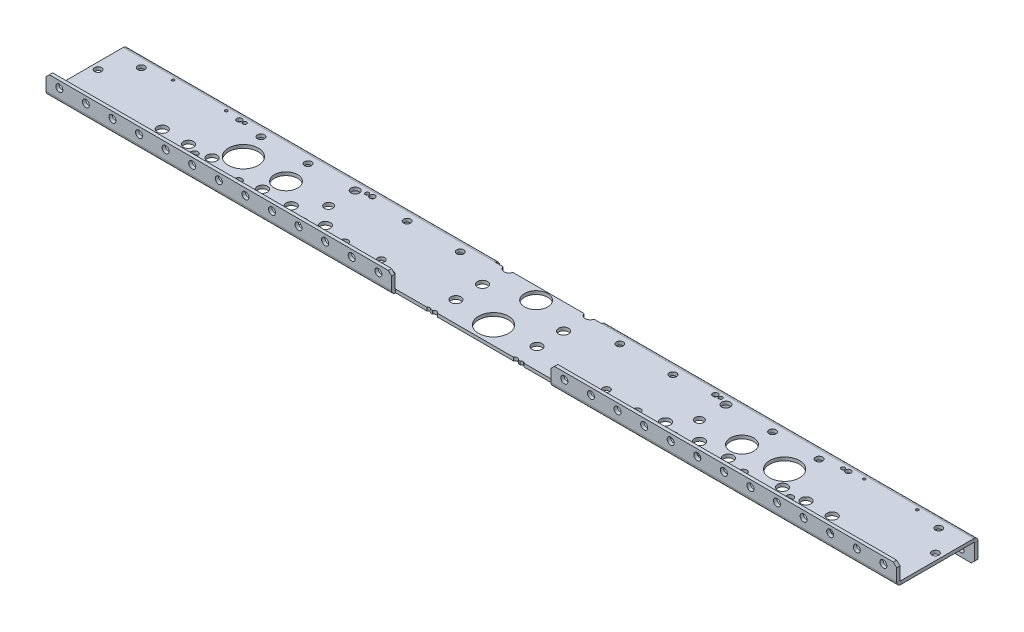
from build123d import *

# Parameters (mm, degrees)
SKETCH1_W                              = 812.8
SKETCH1_H                              = 69.85
BOSS_EXTRUDE1_DEPTH                    = 3.175
SKETCH3_R                              = 14.2875
CUT_EXTRUDE1_DEPTH                     = 816.802024467
EDGE_FLANGE1_DEPTH                     = 812.8
EDGE_FLANGE2_DEPTH                     = 812.8
SKETCH10_R                             = 4.826
LONG_6WD_DEPTH                         = 817.444922817
SKETCH11_R                             = 4.826
SHORT_6WD_DEPTH                        = 817.444922817
SKETCH12_R                             = 3.3528
F_8WD_EGG_DEPTH                        = 817.444922817
SKETCH13_R                             = 3.3528
LOWER_CHURRO_DEPTH                     = 817.444922817
SKETCH14_R                             = 2.667
UPPER_FLANGE_HP_DEPTH                  = 817.729920277
SKETCH16_R                             = 3.3528
LOWER_FLANGE_HP_DEPTH                  = 817.433889486
LPATTERN1_COUNT                        = 32
LPATTERN1_PITCH                        = 25.4
SKETCH17_W                             = 152.4
SKETCH17_H                             = 6.35
CUT_EXTRUDE9_DEPTH                     = 818.031193633
SKETCH18_W                             = 146.05
SKETCH18_H                             = 3.175
BOSS_EXTRUDE2_DEPTH                    = 19.05
SKETCH19_W                             = 101.6
SKETCH19_H                             = 3.937
CUT_EXTRUDE10_DEPTH                    = 818.031193633
SKETCH20_W                             = 95.25
SKETCH20_H                             = 3.175
BOSS_EXTRUDE3_DEPTH                    = 27.432
CUT_EXTRUDE14_DEPTH                    = 819.902667079
SKETCH21_R                             = 11.1125
SKETCH21_R_2                           = 4.7625
SKETCH21_R_3                           = 2.54
SKETCH21_R_4                           = 2.032
TB_MINI_SHAFT_PLATE_DEPTH              = 819.8226487
CUT_EXTRUDE12_DEPTH                    = 819.8226487
SKETCH23_R                             = 3.3528
UPPER_INTERNAL_CHIRRO_HP_DEPTH         = 819.8226487
SKETCH24_R                             = 1.27
CUTTING_GUIDES_DEPTH                   = 819.8226487
SKETCH26_R                             = 3.4036
SONIC_MOUNTING_HOLES_DEPTH             = 819.902667079
SKETCH29_R                             = 2.5527
SKETCH29_R_2                           = 1.7859375
SKETCH29_R_3                           = 14.2875
SKETCH29_R_4                           = 11.1125
SKETCH29_R_5                           = 4.064
TB_MICRO_MOUNTING_DEPTH                = 819.902667079
FILLET1_R                              = 3.175
CHAMFER1_SIZE                          = 3.175
SKETCH30_R                             = 3.3528
BOTTOM_CORNER_SUPPORT_USE_CHURRO_DEPTH = 819.902667079
SKETCH32_R                             = 3.3528
CUT_EXTRUDE15_DEPTH                    = 819.902667079
SKETCH33_R                             = 3.3528
CUT_EXTRUDE16_DEPTH                    = 819.902667079
CUT_EXTRUDE17_DEPTH                    = 12.7


# Sheet-metal steps are written as plain solids
with BuildPart() as part:
    # Sketch1 → Boss-Extrude1 (new body)
    with BuildSketch(Plane(origin=(0, 0, 0), x_dir=(1, 0, 0), z_dir=(0, 1, 0))):
        with Locations((406.4, 34.925)):
            Rectangle(SKETCH1_W, SKETCH1_H)
    extrude(amount=BOSS_EXTRUDE1_DEPTH)

    # Sketch3 → Cut-Extrude1 (cut, through all)
    with BuildSketch(Plane(origin=(0, 3.175, 0), x_dir=(1, 0, 0), z_dir=(0, 1, 0))):
        with Locations(Location((406.4, 17.272, 0), (0, 0, 270))):
            Circle(SKETCH3_R)
    extrude(amount=-CUT_EXTRUDE1_DEPTH, mode=Mode.SUBTRACT)

    # Edge-Flange1 section (across the edge) → Edge-Flange1 (add)
    with BuildSketch(Plane(origin=(0, 3.175, 0.762), x_dir=(0, 0, -1), z_dir=(1, 0, 0))):
        with BuildLine():
            Line((-3.175, 0.762), (-3.175, 15.875))
            Line((-3.175, 15.875), (0, 15.875))
            Line((0, 15.875), (0, 0.762))
            ThreePointArc((0, 0.762), (0.223184633, 0.223184633), (0.762, 0))
            Line((0.762, 0), (0.762, -3.175))
            ThreePointArc((0.762, -3.175), (-2.021879398, -2.021879398), (-3.175, 0.762))
        make_face()
    extrude(amount=EDGE_FLANGE1_DEPTH)

    # Edge-Flange2 section (across the edge) → Edge-Flange2 (add)
    with BuildSketch(Plane(origin=(0, 0, -70.612), x_dir=(0, 0, 1), z_dir=(1, 0, 0))):
        with BuildLine():
            Line((-3.175, 0.762), (-3.175, 19.05))
            Line((-3.175, 19.05), (0, 19.05))
            Line((0, 19.05), (0, 0.762))
            ThreePointArc((0, 0.762), (0.223184633, 0.223184633), (0.762, 0))
            Line((0.762, 0), (0.762, -3.175))
            ThreePointArc((0.762, -3.175), (-2.021879398, -2.021879398), (-3.175, 0.762))
        make_face()
    extrude(amount=EDGE_FLANGE2_DEPTH)

    # Sketch10 → Long 6wd (cut, through all)
    with BuildSketch(Plane(origin=(0, 3.175, 0), x_dir=(1, 0, 0), z_dir=(0, 1, 0))):
        with Locations(Location((86.339113657, 20.828, 0), (0, 0, 270))):
            Circle(SKETCH10_R)
        with Locations(Location((111.349627997, 20.828, 0), (0, 0, 270))):
            Circle(SKETCH10_R)
        with Locations(Location((133.855797334, 20.828, 0), (0, 0, 270))):
            Circle(SKETCH10_R)
        with Locations(Location((726.460886343, 20.828, 0), (0, 0, 270))):
            Circle(SKETCH10_R)
        with Locations(Location((701.450372003, 20.828, 0), (0, 0, 270))):
            Circle(SKETCH10_R)
        with Locations(Location((678.944202666, 20.828, 0), (0, 0, 270))):
            Circle(SKETCH10_R)
    extrude(amount=-LONG_6WD_DEPTH, mode=Mode.SUBTRACT)

    # Sketch11 → Short 6wd (cut, through all)
    with BuildSketch(Plane(origin=(0, 3.175, 0), x_dir=(1, 0, 0), z_dir=(0, 1, 0))):
        with Locations(Location((183.852302373, 19.05, 0), (0, 0, 270))):
            Circle(SKETCH11_R)
        with Locations(Location((211.361504088, 19.05, 0), (0, 0, 270))):
            Circle(SKETCH11_R)
        with Locations(Location((243.875125248, 19.05, 0), (0, 0, 270))):
            Circle(SKETCH11_R)
        with Locations(Location((568.924874752, 19.05, 0), (0, 0, 270))):
            Circle(SKETCH11_R)
        with Locations(Location((601.438495912, 19.05, 0), (0, 0, 270))):
            Circle(SKETCH11_R)
        with Locations(Location((628.947697627, 19.05, 0), (0, 0, 270))):
            Circle(SKETCH11_R)
    extrude(amount=-SHORT_6WD_DEPTH, mode=Mode.SUBTRACT)

    # Sketch12 → 8wd egg (cut, through all)
    with BuildSketch(Plane(origin=(0, 3.175, 0), x_dir=(1, 0, 0), z_dir=(0, 1, 0))):
        with Locations(Location((298.874532383, 17.547282407, 0), (0, 0, 270))):
            Circle(SKETCH12_R)
        with Locations(Location((513.925467617, 17.547282407, 0), (0, 0, 270))):
            Circle(SKETCH12_R)
    extrude(amount=-F_8WD_EGG_DEPTH, mode=Mode.SUBTRACT)

    # Sketch13 → lower churro (cut, through all)
    with BuildSketch(Plane(origin=(0, 3.175, 0), x_dir=(1, 0, 0), z_dir=(0, 1, 0))):
        with Locations(Location((165.1, 14.732, 0), (0, 0, 270))):
            Circle(SKETCH13_R)
        with Locations(Location((266.7, 14.732, 0), (0, 0, 270))):
            Circle(SKETCH13_R)
        with Locations(Location((546.1, 14.732, 0), (0, 0, 270))):
            Circle(SKETCH13_R)
        with Locations(Location((647.7, 14.732, 0), (0, 0, 270))):
            Circle(SKETCH13_R)
    extrude(amount=-LOWER_CHURRO_DEPTH, mode=Mode.SUBTRACT)

    # Sketch14 → upper flange HP (cut, through all)
    with BuildSketch(Plane(origin=(0, 0, -73.787), x_dir=(-1, 0, 0), z_dir=(0, 0, -1))):
        with Locations(Location((-12.7, -12.7, 0), (0, 0, 90))):
            Circle(SKETCH14_R)
        with Locations(Location((-38.1, -12.7, 0), (0, 0, 90))):
            Circle(SKETCH14_R)
        with Locations(Location((-63.5, -12.7, 0), (0, 0, 90))):
            Circle(SKETCH14_R)
        with Locations(Location((-88.9, -12.7, 0), (0, 0, 90))):
            Circle(SKETCH14_R)
        with Locations(Location((-114.3, -12.7, 0), (0, 0, 90))):
            Circle(SKETCH14_R)
        with Locations(Location((-139.7, -12.7, 0), (0, 0, 90))):
            Circle(SKETCH14_R)
        with Locations(Location((-165.1, -12.7, 0), (0, 0, 90))):
            Circle(SKETCH14_R)
        with Locations(Location((-190.5, -12.7, 0), (0, 0, 90))):
            Circle(SKETCH14_R)
        with Locations(Location((-215.9, -12.7, 0), (0, 0, 90))):
            Circle(SKETCH14_R)
        with Locations(Location((-241.3, -12.7, 0), (0, 0, 90))):
            Circle(SKETCH14_R)
        with Locations(Location((-266.7, -12.7, 0), (0, 0, 90))):
            Circle(SKETCH14_R)
        with Locations(Location((-292.1, -12.7, 0), (0, 0, 90))):
            Circle(SKETCH14_R)
        with Locations(Location((-317.5, -12.7, 0), (0, 0, 90))):
            Circle(SKETCH14_R)
        with Locations(Location((-342.9, -12.7, 0), (0, 0, 90))):
            Circle(SKETCH14_R)
        with Locations(Location((-368.3, -12.7, 0), (0, 0, 90))):
            Circle(SKETCH14_R)
        with Locations(Location((-393.7, -12.7, 0), (0, 0, 90))):
            Circle(SKETCH14_R)
        with Locations(Location((-419.1, -12.7, 0), (0, 0, 90))):
            Circle(SKETCH14_R)
        with Locations(Location((-444.5, -12.7, 0), (0, 0, 90))):
            Circle(SKETCH14_R)
        with Locations(Location((-469.9, -12.7, 0), (0, 0, 90))):
            Circle(SKETCH14_R)
        with Locations(Location((-495.3, -12.7, 0), (0, 0, 90))):
            Circle(SKETCH14_R)
        with Locations(Location((-520.7, -12.7, 0), (0, 0, 90))):
            Circle(SKETCH14_R)
        with Locations(Location((-546.1, -12.7, 0), (0, 0, 90))):
            Circle(SKETCH14_R)
        with Locations(Location((-571.5, -12.7, 0), (0, 0, 90))):
            Circle(SKETCH14_R)
        with Locations(Location((-596.9, -12.7, 0), (0, 0, 90))):
            Circle(SKETCH14_R)
        with Locations(Location((-622.3, -12.7, 0), (0, 0, 90))):
            Circle(SKETCH14_R)
        with Locations(Location((-647.7, -12.7, 0), (0, 0, 90))):
            Circle(SKETCH14_R)
        with Locations(Location((-673.1, -12.7, 0), (0, 0, 90))):
            Circle(SKETCH14_R)
        with Locations(Location((-698.5, -12.7, 0), (0, 0, 90))):
            Circle(SKETCH14_R)
        with Locations(Location((-723.9, -12.7, 0), (0, 0, 90))):
            Circle(SKETCH14_R)
        with Locations(Location((-749.3, -12.7, 0), (0, 0, 90))):
            Circle(SKETCH14_R)
        with Locations(Location((-774.7, -12.7, 0), (0, 0, 90))):
            Circle(SKETCH14_R)
        with Locations(Location((-800.1, -12.7, 0), (0, 0, 90))):
            Circle(SKETCH14_R)
    extrude(amount=-UPPER_FLANGE_HP_DEPTH, mode=Mode.SUBTRACT)

    # Sketch16 → Lower flange HP (cut, through all)
    with BuildSketch(Plane(origin=(0, 0, 0.762), x_dir=(-1, 0, 0), z_dir=(0, 0, -1))):
        with Locations(Location((-12.7, 12.7, 0), (0, 0, 90))):
            Circle(SKETCH16_R)
    lower_flange_hp = extrude(amount=-LOWER_FLANGE_HP_DEPTH, mode=Mode.SUBTRACT)

    # LPattern1: Lower flange HP ×32
    with Locations(*[(i * LPATTERN1_PITCH, 0, 0) for i in range(1, LPATTERN1_COUNT)]):
        add(lower_flange_hp, mode=Mode.SUBTRACT)

    # Sketch17 → Cut-Extrude9 (cut, through all)
    with BuildSketch(Plane(origin=(0, 19.05, 0), x_dir=(1, 0, 0), z_dir=(0, 1, 0))):
        with Locations((406.4, -3.175)):
            Rectangle(SKETCH17_W, SKETCH17_H)
    extrude(amount=-CUT_EXTRUDE9_DEPTH, mode=Mode.SUBTRACT)

    # Sketch18 → Boss-Extrude2 (add)
    with BuildSketch(Plane.XY):
        with Locations((406.4, 1.5875)):
            Rectangle(SKETCH18_W, SKETCH18_H)
    extrude(amount=BOSS_EXTRUDE2_DEPTH)

    # Sketch19 → Cut-Extrude10 (cut, through all)
    with BuildSketch(Plane.XZ.offset(19.05)):
        with Locations((406.4, -71.8185)):
            Rectangle(SKETCH19_W, SKETCH19_H)
    extrude(amount=-CUT_EXTRUDE10_DEPTH, mode=Mode.SUBTRACT)

    # Sketch20 → Boss-Extrude3 (add)
    with BuildSketch(Plane(origin=(0, 0, -69.85), x_dir=(-1, 0, 0), z_dir=(0, 0, -1))):
        with Locations((-406.4, 1.5875)):
            Rectangle(SKETCH20_W, SKETCH20_H)
    extrude(amount=BOSS_EXTRUDE3_DEPTH)

    # Sketch27 → Cut-Extrude14 (cut, through all)
    with BuildSketch(Plane(origin=(0, 3.175, 0), x_dir=(1, 0, 0), z_dir=(0, 1, 0))):
        Polygon((333.375, 0), (344.373522628, -19.05), (333.375, -19.05), align=None)
        Polygon((479.425, 0), (479.425, -19.05), (468.426477372, -19.05), align=None)
    extrude(amount=-CUT_EXTRUDE14_DEPTH, mode=Mode.SUBTRACT)

    # Sketch21 → TB Mini Shaft plate (cut, through all)
    with BuildSketch(Plane.XZ):
        with Locations(Location((406.4, -57.9628, 0), (0, 0, 270))):
            Circle(SKETCH21_R)
        with Locations(Location((445.12429721, -45.466, 0), (0, 0, 270))):
            Circle(SKETCH21_R_2)
        with Locations(Location((367.67570279, -45.466, 0), (0, 0, 270))):
            Circle(SKETCH21_R_2)
        with Locations(Location((445.12429721, -70.866, 0), (0, 0, 270))):
            Circle(SKETCH21_R_2)
        with Locations(Location((445.12429721, -20.066, 0), (0, 0, 270))):
            Circle(SKETCH21_R_2)
        with Locations(Location((367.67570279, -20.066, 0), (0, 0, 270))):
            Circle(SKETCH21_R_2)
        with Locations(Location((367.67570279, -70.866, 0), (0, 0, 270))):
            Circle(SKETCH21_R_2)
        with Locations(Location((438.15, -87.85352, 0), (0, 0, 270))):
            Circle(SKETCH21_R_3)
        with Locations(Location((374.65, -87.85352, 0), (0, 0, 270))):
            Circle(SKETCH21_R_3)
        with Locations(Location((443.992, -87.85352, 0), (0, 0, 270))):
            Circle(SKETCH21_R_4)
        with Locations(Location((368.808, -87.85352, 0), (0, 0, 270))):
            Circle(SKETCH21_R_4)
        with Locations(Location((445.0461, 1.03886, 0), (0, 0, 270))):
            Circle(SKETCH21_R_3)
        with Locations(Location((367.7539, 1.03886, 0), (0, 0, 270))):
            Circle(SKETCH21_R_3)
        with Locations(Location((361.9119, 1.03886, 0), (0, 0, 270))):
            Circle(SKETCH21_R_4)
        with Locations(Location((450.8881, 1.03886, 0), (0, 0, 270))):
            Circle(SKETCH21_R_4)
    extrude(amount=-TB_MINI_SHAFT_PLATE_DEPTH, mode=Mode.SUBTRACT)

    # Sketch22 → Cut-Extrude12 (cut, through all)
    with BuildSketch(Plane.XZ):
        Polygon((454.025, -69.85), (444.579404912, -97.282), (454.025, -97.282), align=None)
        Polygon((358.775, -69.85), (368.220595088, -97.282), (358.775, -97.282), align=None)
    extrude(amount=-CUT_EXTRUDE12_DEPTH, mode=Mode.SUBTRACT)

    # Sketch23 → Upper internal chirro HP (cut, through all)
    with BuildSketch(Plane.XZ):
        with Locations(Location((330.2, -61.722, 0), (0, 0, 270))):
            Circle(SKETCH23_R)
        with Locations(Location((279.4, -61.722, 0), (0, 0, 270))):
            Circle(SKETCH23_R)
        with Locations(Location((139.7, -61.722, 0), (0, 0, 270))):
            Circle(SKETCH23_R)
        with Locations(Location((25.4, -61.722, 0), (0, 0, 270))):
            Circle(SKETCH23_R)
        with Locations(Location((482.6, -61.722, 0), (0, 0, 270))):
            Circle(SKETCH23_R)
        with Locations(Location((533.4, -61.722, 0), (0, 0, 270))):
            Circle(SKETCH23_R)
        with Locations(Location((673.1, -61.722, 0), (0, 0, 270))):
            Circle(SKETCH23_R)
        with Locations(Location((787.4, -61.722, 0), (0, 0, 270))):
            Circle(SKETCH23_R)
        with Locations(Location((6.35, -39.497, 0), (0, 0, 270))):
            Circle(SKETCH23_R)
        with Locations(Location((806.45, -39.497, 0), (0, 0, 270))):
            Circle(SKETCH23_R)
    extrude(amount=-UPPER_INTERNAL_CHIRRO_HP_DEPTH, mode=Mode.SUBTRACT)

    # Sketch24 → Cutting guides (cut, through all)
    with BuildSketch(Plane.XZ):
        with Locations(Location((101.6, -3.175, 0), (0, 0, 270))):
            Circle(SKETCH24_R)
        with Locations(Location((101.6, -66.675, 0), (0, 0, 270))):
            Circle(SKETCH24_R)
        with Locations(Location((50.8, -66.675, 0), (0, 0, 270))):
            Circle(SKETCH24_R)
        with Locations(Location((50.8, -3.175, 0), (0, 0, 270))):
            Circle(SKETCH24_R)
        with Locations(Location((762, -66.675, 0), (0, 0, 270))):
            Circle(SKETCH24_R)
        with Locations(Location((762, -3.175, 0), (0, 0, 270))):
            Circle(SKETCH24_R)
        with Locations(Location((711.2, -3.175, 0), (0, 0, 270))):
            Circle(SKETCH24_R)
        with Locations(Location((711.2, -66.675, 0), (0, 0, 270))):
            Circle(SKETCH24_R)
    extrude(amount=-CUTTING_GUIDES_DEPTH, mode=Mode.SUBTRACT)

    # Sketch26 → Sonic mounting holes (cut, through all)
    with BuildSketch(Plane(origin=(0, 3.175, 0), x_dir=(1, 0, 0), z_dir=(0, 1, 0))):
        with Locations(Location((350.8375, -12.8905, 0), (0, 0, 270))):
            Circle(SKETCH26_R)
        with Locations(Location((461.9625, -12.8905, 0), (0, 0, 270))):
            Circle(SKETCH26_R)
    extrude(amount=-SONIC_MOUNTING_HOLES_DEPTH, mode=Mode.SUBTRACT)

    # Sketch29 → TB Micro Mounting (cut, through all)
    with BuildSketch(Plane(origin=(0, 3.175, 0), x_dir=(1, 0, 0), z_dir=(0, 1, 0))):
        with Locations(Location((115.520362832, 65.405, 0), (0, 0, 270))):
            Circle(SKETCH29_R)
        with Locations(Location((120.600362832, 65.405, 0), (0, 0, 270))):
            Circle(SKETCH29_R_2)
        with Locations(Location((147.829162832, 36.83, 0), (0, 0, 270))):
            Circle(SKETCH29_R_3)
        with Locations(Location((115.520362832, 8.255, 0), (0, 0, 270))):
            Circle(SKETCH29_R)
        with Locations(Location((120.600362832, 8.255, 0), (0, 0, 270))):
            Circle(SKETCH29_R_2)
        with Locations(Location((188.545362832, 36.83, 0), (0, 0, 270))):
            Circle(SKETCH29_R_4)
        with Locations(Location((229.261562832, 36.83, 0), (0, 0, 270))):
            Circle(SKETCH29_R_5)
        with Locations(Location((229.261562832, 62.23, 0), (0, 0, 270))):
            Circle(SKETCH29_R_5)
        with Locations(Location((229.261562832, 11.43, 0), (0, 0, 270))):
            Circle(SKETCH29_R_5)
        with Locations(Location((237.440362832, 8.255, 0), (0, 0, 270))):
            Circle(SKETCH29_R_2)
        with Locations(Location((242.520362832, 8.255, 0), (0, 0, 270))):
            Circle(SKETCH29_R)
        with Locations(Location((237.440362832, 65.405, 0), (0, 0, 270))):
            Circle(SKETCH29_R_2)
        with Locations(Location((242.520362832, 65.405, 0), (0, 0, 270))):
            Circle(SKETCH29_R)
        with Locations(Location((570.279637168, 65.405, 0), (0, 0, 270))):
            Circle(SKETCH29_R)
        with Locations(Location((575.359637168, 65.405, 0), (0, 0, 270))):
            Circle(SKETCH29_R_2)
        with Locations(Location((583.538437168, 62.23, 0), (0, 0, 270))):
            Circle(SKETCH29_R_5)
        with Locations(Location((583.538437168, 36.83, 0), (0, 0, 270))):
            Circle(SKETCH29_R_5)
        with Locations(Location((624.254637168, 36.83, 0), (0, 0, 270))):
            Circle(SKETCH29_R_4)
        with Locations(Location((570.279637168, 8.255, 0), (0, 0, 270))):
            Circle(SKETCH29_R)
        with Locations(Location((575.359637168, 8.255, 0), (0, 0, 270))):
            Circle(SKETCH29_R_2)
        with Locations(Location((583.538437168, 11.43, 0), (0, 0, 270))):
            Circle(SKETCH29_R_5)
        with Locations(Location((664.970837168, 36.83, 0), (0, 0, 270))):
            Circle(SKETCH29_R_3)
        with Locations(Location((692.199637168, 65.405, 0), (0, 0, 270))):
            Circle(SKETCH29_R_2)
        with Locations(Location((697.279637168, 65.405, 0), (0, 0, 270))):
            Circle(SKETCH29_R)
        with Locations(Location((692.199637168, 8.255, 0), (0, 0, 270))):
            Circle(SKETCH29_R_2)
        with Locations(Location((697.279637168, 8.255, 0), (0, 0, 270))):
            Circle(SKETCH29_R)
    extrude(amount=-TB_MICRO_MOUNTING_DEPTH, mode=Mode.SUBTRACT)

    # Fillet1
    fillet1_edges = [part.edges().sort_by_distance(p)[0] for p in [
        (333.375, 1.5875, 0),
        (479.425, 1.5875, 0),
        (454.025, 1.5875, -69.85),
        (358.775, 1.5875, -69.85),
        (468.426477372, 1.5875, 19.05),
        (344.373522628, 1.5875, 19.05),
        (368.220595088, 1.5875, -97.282),
        (444.579404912, 1.5875, -97.282),
    ]]
    fillet(fillet1_edges, radius=FILLET1_R)

    # Chamfer1
    chamfer1_edges = [part.edges().sort_by_distance(p)[0] for p in [
        (0, 19.05, 2.3495),
        (812.8, 19.05, 2.3495),
        (482.6, 19.05, 2.3495),
        (330.2, 19.05, 2.3495),
        (0, -19.05, -72.1995),
        (812.8, -19.05, -72.1995),
        (355.6, -19.05, -72.1995),
        (457.2, -19.05, -72.1995),
    ]]
    chamfer(chamfer1_edges, length=CHAMFER1_SIZE)

    # Sketch30 → Bottom Corner Support (use churro) (cut, through all)
    with BuildSketch(Plane(origin=(0, 3.175, 0), x_dir=(1, 0, 0), z_dir=(0, 1, 0))):
        with Locations(Location((72.898, 9.525, 0), (0, 0, 270))):
            Circle(SKETCH30_R)
        with Locations(Location((121.92, 15.875, 0), (0, 0, 270))):
            Circle(SKETCH30_R)
        with Locations(Location((739.902, 9.525, 0), (0, 0, 90))):
            Circle(SKETCH30_R)
        with Locations(Location((690.88, 15.875, 0), (0, 0, 90))):
            Circle(SKETCH30_R)
    extrude(amount=-BOTTOM_CORNER_SUPPORT_USE_CHURRO_DEPTH, mode=Mode.SUBTRACT)

    # Sketch32 → Cut-Extrude15 (cut, through all)
    with BuildSketch(Plane(origin=(0, 3.175, 0), x_dir=(1, 0, 0), z_dir=(0, 1, 0))):
        with Locations(Location((184.480781416, 61.976, 0), (0, 0, 270))):
            Circle(SKETCH32_R)
        with Locations(Location((628.319218584, 61.976, 0), (0, 0, 90))):
            Circle(SKETCH32_R)
    extrude(amount=-CUT_EXTRUDE15_DEPTH, mode=Mode.SUBTRACT)

    # Sketch33 → Cut-Extrude16 (cut, through all)
    with BuildSketch(Plane(origin=(0, 3.175, 0), x_dir=(1, 0, 0), z_dir=(0, 1, 0))):
        with Locations(Location((200.025, 10.287, 0), (0, 0, 270))):
            Circle(SKETCH33_R)
        with Locations(Location((314.325, 10.287, 0), (0, 0, 270))):
            Circle(SKETCH33_R)
        with Locations(Location((498.475, 10.287, 0), (0, 0, 90))):
            Circle(SKETCH33_R)
        with Locations(Location((612.775, 10.287, 0), (0, 0, 90))):
            Circle(SKETCH33_R)
    extrude(amount=-CUT_EXTRUDE16_DEPTH, mode=Mode.SUBTRACT)

    # Sketch34 → Cut-Extrude17 (cut)
    with BuildSketch(Plane(origin=(0, 3.175, 0), x_dir=(1, 0, 0), z_dir=(0, 1, 0))):
        Polygon((330.2, 0), (343.60386177, -32.545574972), (471.637053834, -32.545574972), (481.258087105, 0), align=None)
        Polygon((355.6, 69.85), (457.2, 69.85), (447.225268824, 114.179876771), (371.508269574, 114.179876771), align=None)
    extrude(amount=-CUT_EXTRUDE17_DEPTH, mode=Mode.SUBTRACT)


solid = part.part
